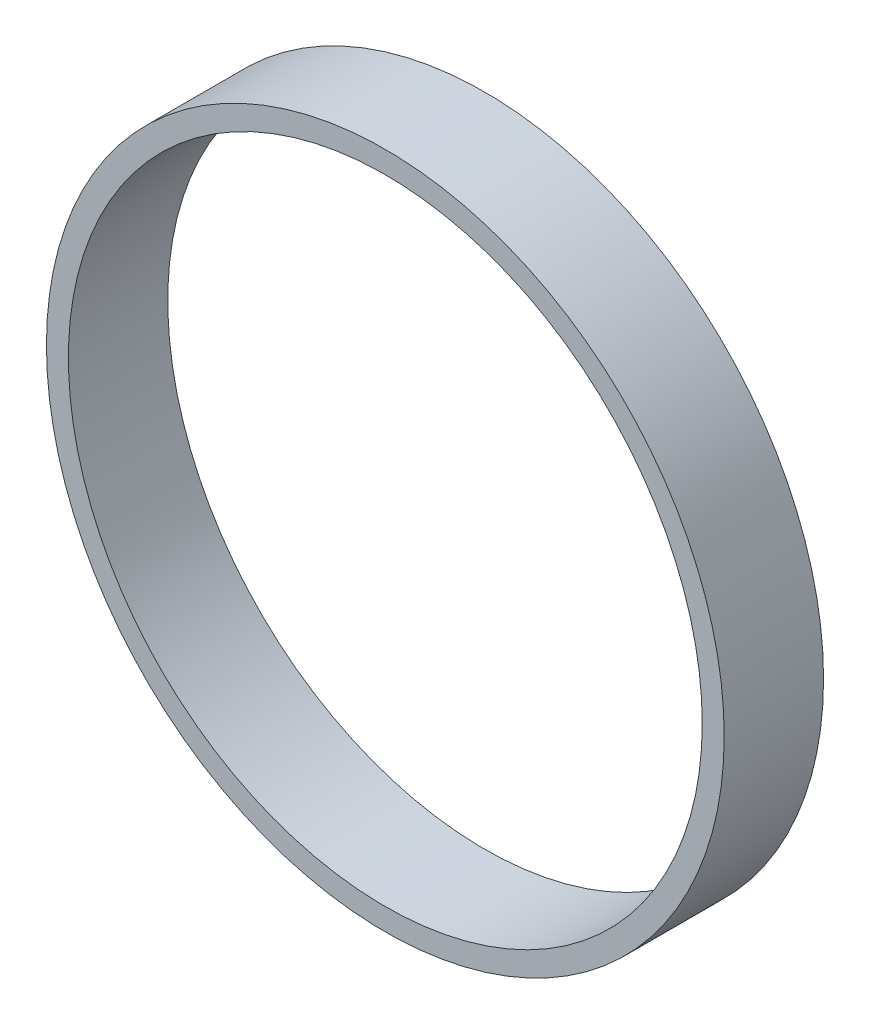
from build123d import *

# Parameters (mm, degrees)
SKETCH1_R           = 34.11
SKETCH1_R_2         = 31.9
BOSS_EXTRUDE1_DEPTH = 10


with BuildPart() as part:
    # Sketch1 → Boss-Extrude1 (new body)
    with BuildSketch(Plane.XY):
        Circle(SKETCH1_R)
        Circle(SKETCH1_R_2, mode=Mode.SUBTRACT)
    extrude(amount=BOSS_EXTRUDE1_DEPTH)


solid = part.part
